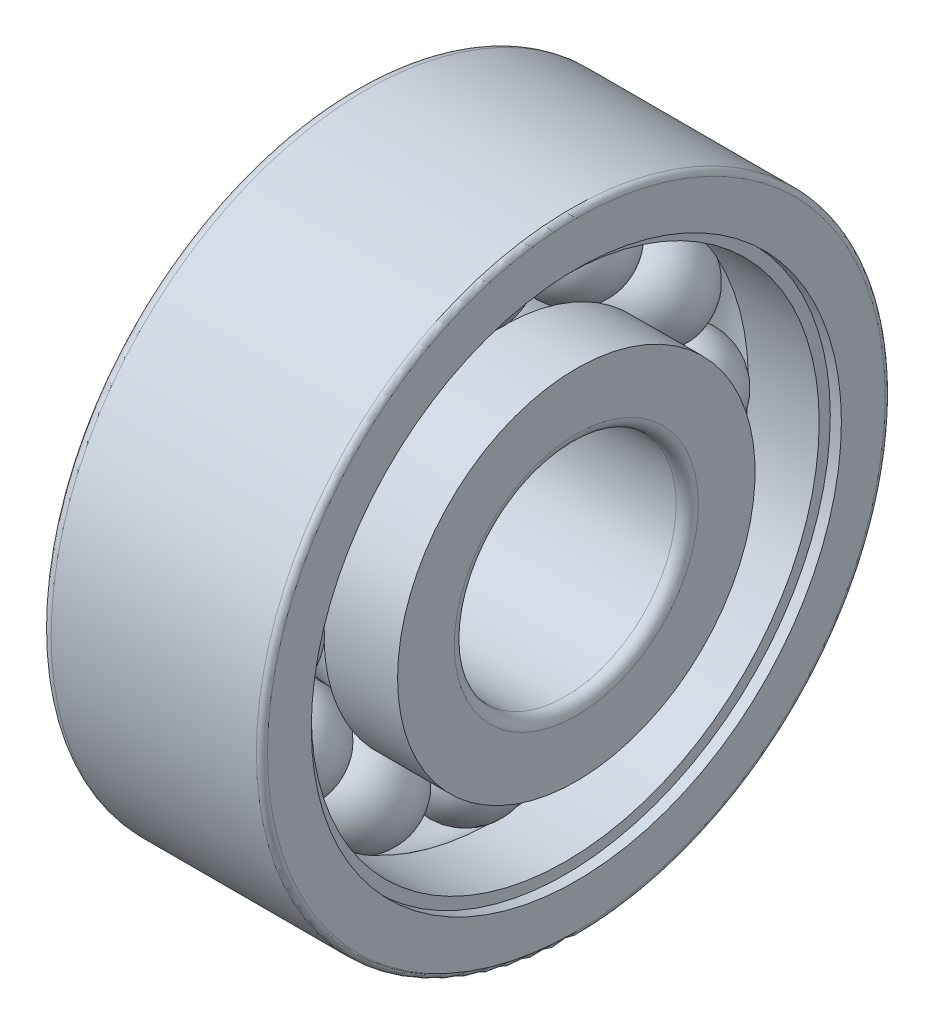
from build123d import *

# Parameters (mm, degrees)
CIRCULAR_PATTERN1_COUNT = 12
FILLET1_R               = 0.3
FILLET2_R               = 0.15


with BuildPart() as part:
    # Sketch1 → Revolve1 (revolve)
    with BuildSketch(Plane.XY):
        with BuildLine():
            Line((-1.375, 5.75), (1.375, 5.75))
            ThreePointArc((1.375, 5.75), (0, 4.375), (-1.375, 5.75))
        make_face()
    revolve1 = revolve(axis=Axis((-3.091912561, 5.75, 0), (1, 0, 0)))

    # Sketch2 → Revolve2 (revolve)
    with BuildSketch(Plane.XY):
        with BuildLine():
            Line((-3, 4.833333333), (-1.011408534, 4.833333333))
            ThreePointArc((-1.011408534, 4.833333333), (0, 4.385), (1.011408534, 4.833333333))
            Line((1.011408534, 4.833333333), (3, 4.833333333))
            Line((3, 4.833333333), (3, 3))
            Line((3, 3), (-3, 3))
            Line((-3, 3), (-3, 4.833333333))
        make_face()
    revolve(axis=Axis((-2.992358943, 0, 0), (1, 0, 0)))

    # Sketch3 → Revolve3 (revolve)
    with BuildSketch(Plane.XY):
        with BuildLine():
            Line((-3, 6.666666667), (-3, 8.5))
            Line((-3, 8.5), (3, 8.5))
            Line((3, 8.5), (3, 7.166666667))
            Line((3, 7.166666667), (2.7, 7.166666667))
            Line((2.7, 7.166666667), (2.7, 6.866666667))
            Line((2.7, 6.866666667), (0.785035385, 6.866666667))
            ThreePointArc((0.785035385, 6.866666667), (-0.151033773, 7.106618517), (-1.011408534, 6.666666667))
            Line((-1.011408534, 6.666666667), (-3, 6.666666667))
        make_face()
    revolve(axis=Axis((-2.992358943, 0, 0), (1, 0, 0)))

    # Circular-Pattern1: Revolve1 ×12 about axis
    circular_pattern1_axis = Axis((-2.992358943, 0, 0), (1, 0, 0))
    for i in range(1, CIRCULAR_PATTERN1_COUNT):
        add(revolve1.rotate(circular_pattern1_axis, i * 360 / CIRCULAR_PATTERN1_COUNT))

    # Fillet1
    fillet1_edges = [part.edges().sort_by_distance(p)[0] for p in [
        (3, -3, 0),
        (-3, -8.5, 0),
    ]]
    fillet(fillet1_edges, radius=FILLET1_R)

    # Fillet2
    fillet2_edges = [part.edges().sort_by_distance(p)[0] for p in [
        (3, -8.5, 0),
        (-3, -3, 0),
    ]]
    fillet(fillet2_edges, radius=FILLET2_R)


solid = part.part
